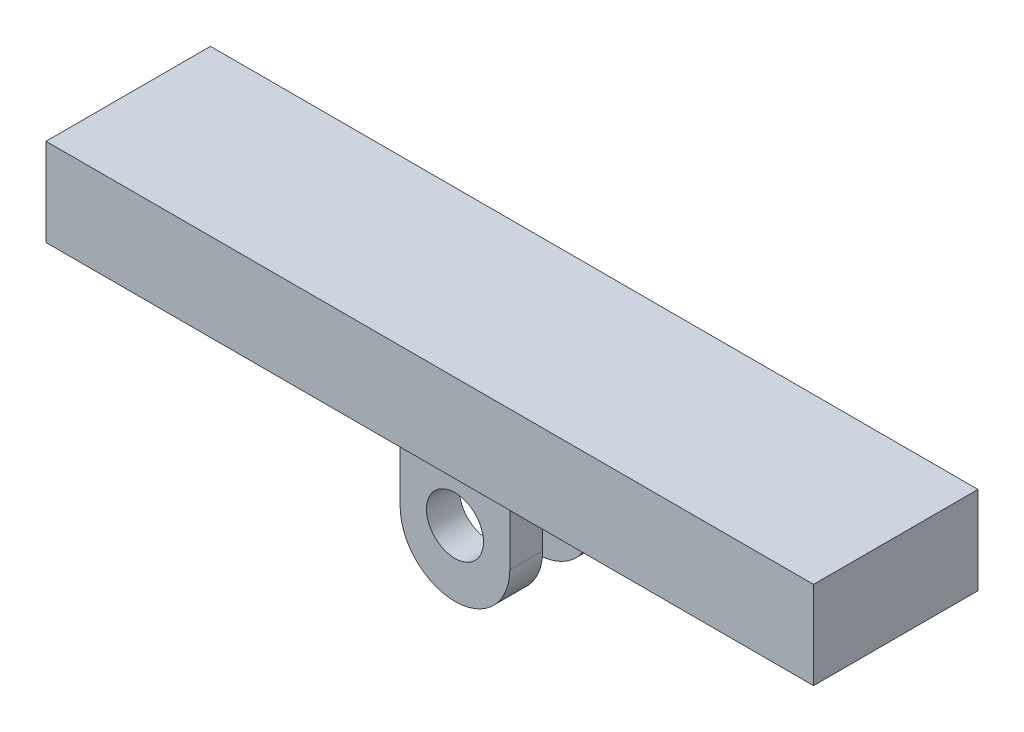
from build123d import *

# Parameters (mm, degrees)
SKETCH1_W           = 8
SKETCH1_H           = 70
BOSS_EXTRUDE1_DEPTH = 15
SKETCH2_W           = 10
SKETCH2_H           = 3
BOSS_EXTRUDE2_DEPTH = 12
SKETCH3_R           = 2.6
CUT_EXTRUDE1_DEPTH  = 12
FILLET1_R           = 5
SCALE1_SCALE        = 0.7


with BuildPart() as part:
    # Sketch1 → Boss-Extrude1 (new body)
    with BuildSketch(Plane(origin=(0, 0, 0), x_dir=(0, 1, 0), z_dir=(0, 0, 1))):
        Rectangle(SKETCH1_W, SKETCH1_H)
    extrude(amount=-BOSS_EXTRUDE1_DEPTH)

    # Sketch2 → Boss-Extrude2 (add)
    with BuildSketch(Plane.XZ.offset(4)):
        with Locations((0, -3.8)):
            Rectangle(SKETCH2_W, SKETCH2_H)
        with Locations((0, -11.3)):
            Rectangle(SKETCH2_W, SKETCH2_H)
    extrude(amount=BOSS_EXTRUDE2_DEPTH)

    # Sketch3 → Cut-Extrude1 (cut)
    with BuildSketch(Plane.XY.offset(-2.3)):
        with Locations((0, -10)):
            Circle(SKETCH3_R)
    extrude(amount=-CUT_EXTRUDE1_DEPTH, mode=Mode.SUBTRACT)

    # Fillet1
    fillet1_edges = [part.edges().sort_by_distance(p)[0] for p in [
        (-5, -16, -11.3),
        (5, -16, -11.3),
        (5, -16, -3.8),
        (-5, -16, -3.8),
    ]]
    fillet(fillet1_edges, radius=FILLET1_R - 0.0001)  # a hair under: the kernel refuses the full size


with BuildPart() as part_1:
    # Scale1: scaled about (0, -0.556396742, -7.502958038)
    add(part.part.scale(SCALE1_SCALE).moved(Location((0, -0.166919023, -2.250887411))))


solid = part_1.part
